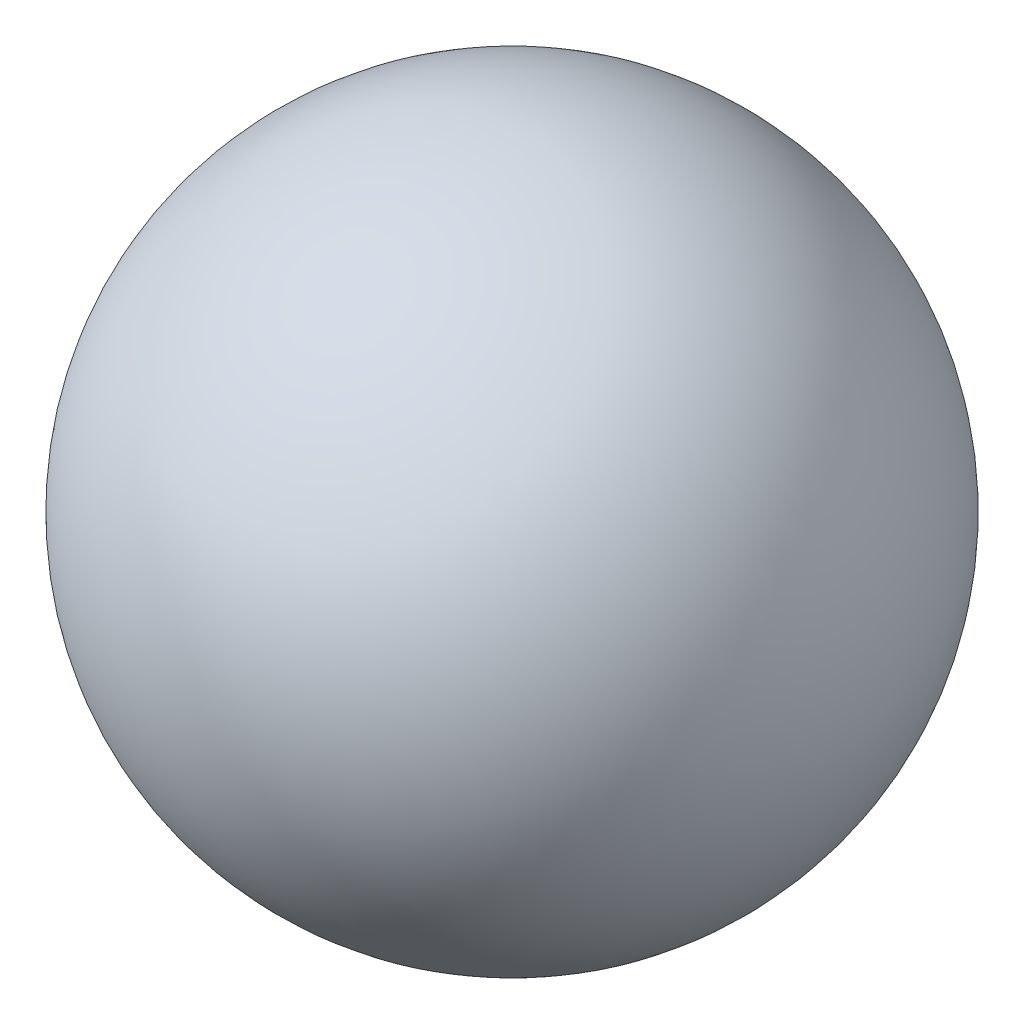
from build123d import *


with BuildPart() as part:
    # Esboço1 → Revolução1 (revolve)
    with BuildSketch(Plane.XY):
        with BuildLine():
            Line((0, 21.3), (0, -21.3))
            ThreePointArc((0, -21.3), (21.3, 0), (0, 21.3))
        make_face()
    revolve(axis=Axis((0, 21.3, 0), (0, -1, 0)))


solid = part.part
